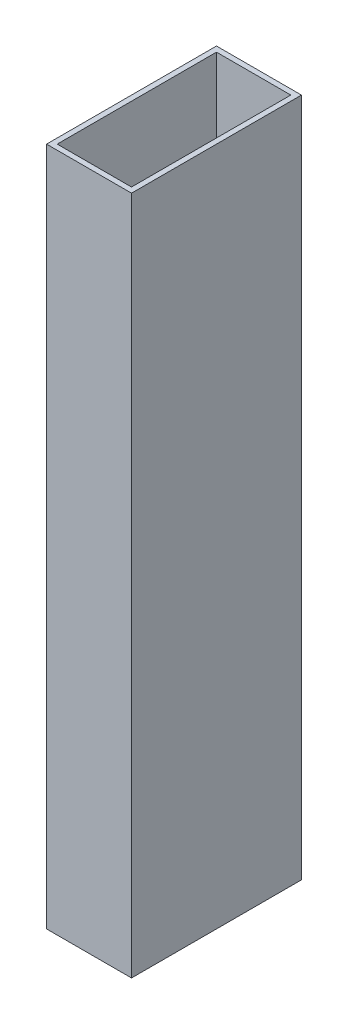
from build123d import *

# Parameters (mm, degrees)
SKETCH1_W           = 25.4
SKETCH1_H           = 50.8
SKETCH1_W_2         = 22.225
SKETCH1_H_2         = 47.625
EXTRUDE_THIN1_DEPTH = 203.2


with BuildPart() as part:
    # Sketch1 → Extrude-Thin1 (new body)
    with BuildSketch(Plane(origin=(0, 0, 0), x_dir=(1, 0, 0), z_dir=(0, 1, 0))):
        Rectangle(SKETCH1_W, SKETCH1_H)
        Rectangle(SKETCH1_W_2, SKETCH1_H_2, mode=Mode.SUBTRACT)
    extrude(amount=EXTRUDE_THIN1_DEPTH)


solid = part.part
